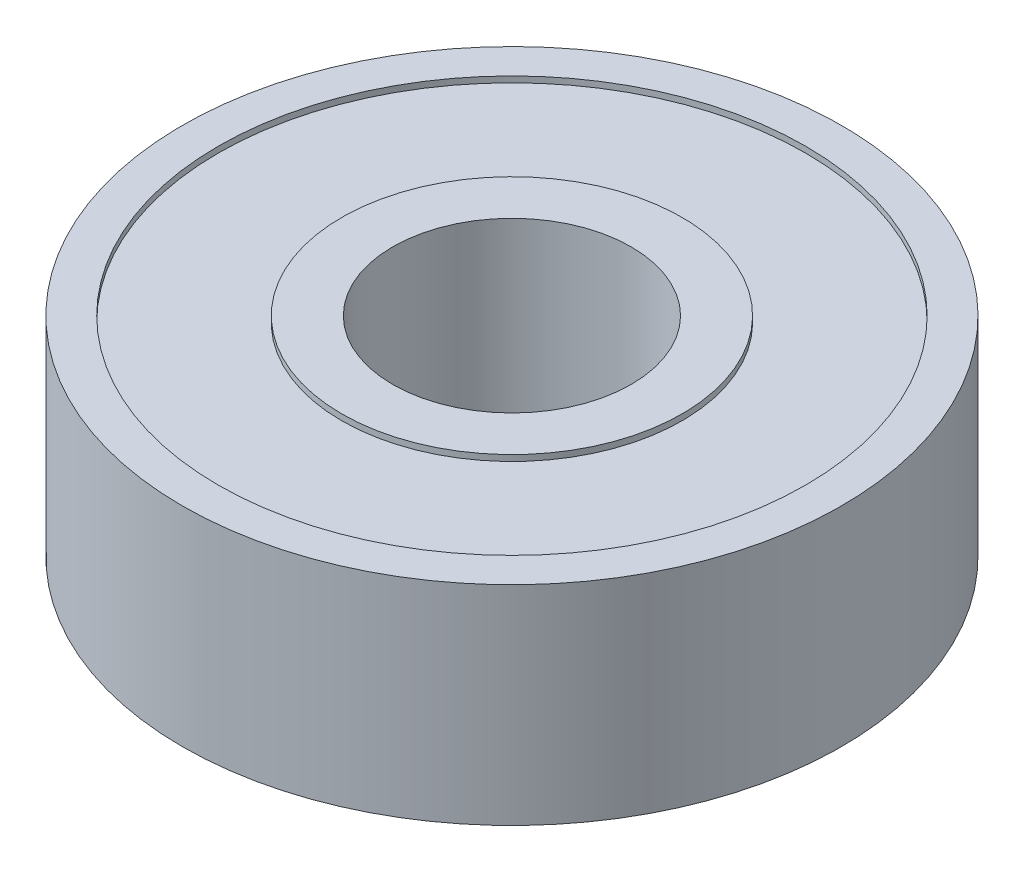
from build123d import *

# Parameters (mm, degrees)
SKETCH3_R           = 11
SKETCH3_R_2         = 3.98
BOSS_EXTRUDE1_DEPTH = 3.48
SKETCH4_R           = 9.8
SKETCH4_R_2         = 5.68
CUT_EXTRUDE1_DEPTH  = 0.2


with BuildPart() as part:
    # Sketch3 → Boss-Extrude1 (new, symmetric)
    with BuildSketch(Plane(origin=(0, 0, 0), x_dir=(1, 0, 0), z_dir=(0, 1, 0))):
        Circle(SKETCH3_R)
        Circle(SKETCH3_R_2, mode=Mode.SUBTRACT)
    extrude(amount=BOSS_EXTRUDE1_DEPTH, both=True)

    # Sketch4 → Cut-Extrude1 (cut)
    with BuildSketch(Plane(origin=(0, 3.48, 0), x_dir=(1, 0, 0), z_dir=(0, 1, 0))):
        Circle(SKETCH4_R)
        Circle(SKETCH4_R_2, mode=Mode.SUBTRACT)
    cut_extrude1 = extrude(amount=-CUT_EXTRUDE1_DEPTH, mode=Mode.SUBTRACT)

    # Mirror1: Cut-Extrude1 across plane
    add(cut_extrude1.mirror(Plane.ZX), mode=Mode.SUBTRACT)


solid = part.part
